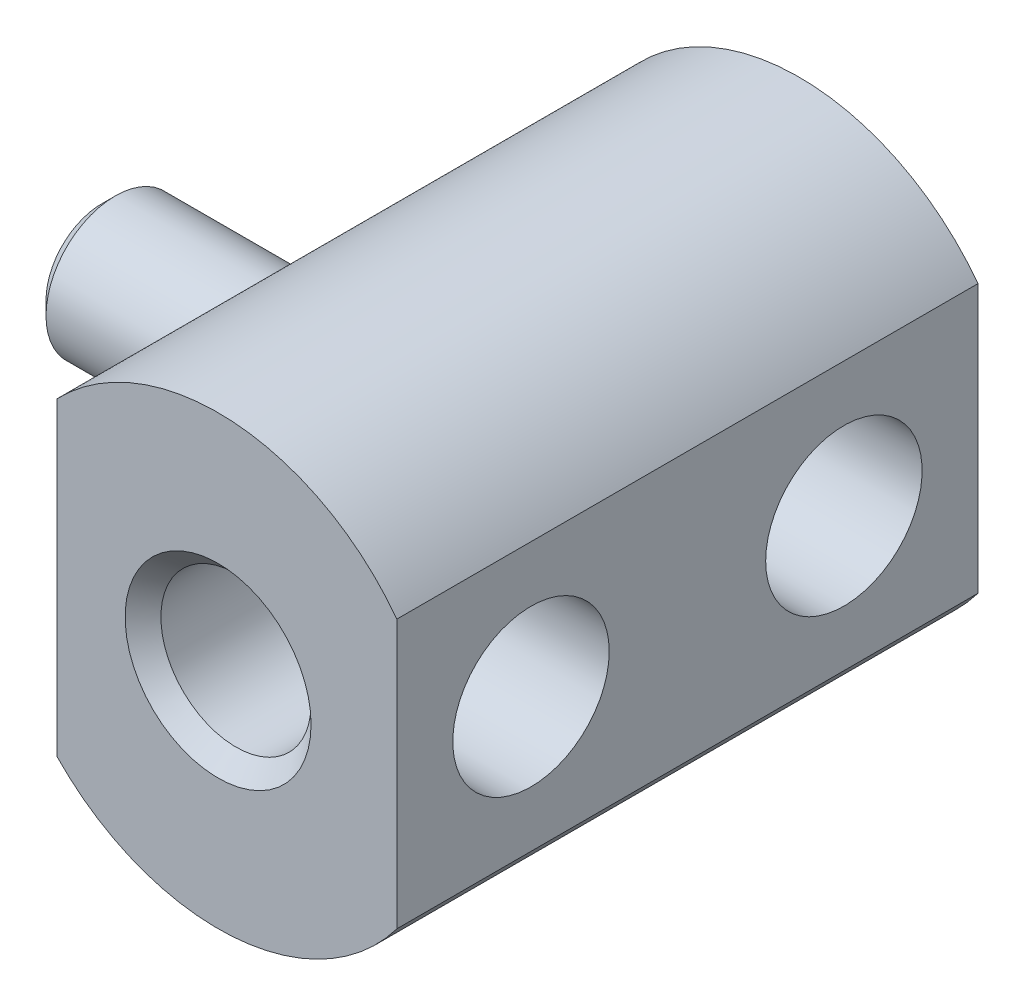
from build123d import *

# Parameters (mm, degrees)
SKETCH1_R           = 6.35
SKETCH1_R_2         = 2.1336
BOSS_EXTRUDE1_DEPTH = 8.255
CUT_EXTRUDE1_DEPTH  = 19.794283705
SKETCH4_R           = 1.9685
BOSS_EXTRUDE2_DEPTH = 6.985
FILLET1_R           = 1.27
CHAMFER1_SIZE       = 0.381
SKETCH5_R           = 2.2225
CUT_EXTRUDE2_DEPTH  = 4.445
CHAMFER2_SIZE       = 0.508


with BuildPart() as part:
    # Sketch1 → Boss-Extrude1 (new, symmetric)
    with BuildSketch(Plane.XY):
        Circle(SKETCH1_R)
        Circle(SKETCH1_R_2, mode=Mode.SUBTRACT)
    extrude(amount=BOSS_EXTRUDE1_DEPTH, both=True)

    # Sketch3 → Cut-Extrude1 (cut, through all)
    with BuildSketch(Plane.XY.offset(8.255)):
        with BuildLine():
            Line((-4.572, 4.4067353), (-4.572, -4.4067353))
            ThreePointArc((-4.572, -4.4067353), (-6.35, 0), (-4.572, 4.4067353))
        make_face()
        with BuildLine():
            Line((5.08, 3.81), (5.08, -3.81))
            ThreePointArc((5.08, -3.81), (6.35, 0), (5.08, 3.81))
        make_face()
    extrude(amount=-CUT_EXTRUDE1_DEPTH, mode=Mode.SUBTRACT)

    # Sketch4 → Boss-Extrude2 (add)
    with BuildSketch(Plane.ZY.offset(4.572)):
        Circle(SKETCH4_R)
    extrude(amount=BOSS_EXTRUDE2_DEPTH)

    # Fillet1
    fillet1_edges = [part.edges().sort_by_distance(p)[0] for p in [
        (-4.572, 0, -1.9685),
    ]]
    fillet(fillet1_edges, radius=FILLET1_R)

    # Chamfer1
    chamfer1_edges = [part.edges().sort_by_distance(p)[0] for p in [
        (-11.557, 0, -1.9685),
    ]]
    chamfer(chamfer1_edges, length=CHAMFER1_SIZE)

    # Sketch5 → Cut-Extrude2 (cut)
    with BuildSketch(Plane(origin=(5.08, 0, 0), x_dir=(0, 0, -1), z_dir=(1, 0, 0))):
        with Locations((-4.445, 0)):
            Circle(SKETCH5_R)
        with Locations((4.445, 0)):
            Circle(SKETCH5_R)
    extrude(amount=-CUT_EXTRUDE2_DEPTH, mode=Mode.SUBTRACT)

    # Chamfer2
    chamfer2_edges = [part.edges().sort_by_distance(p)[0] for p in [
        (-2.1336, 0, -8.255),
        (-2.1336, 0, 8.255),
    ]]
    chamfer(chamfer2_edges, length=CHAMFER2_SIZE)


solid = part.part
